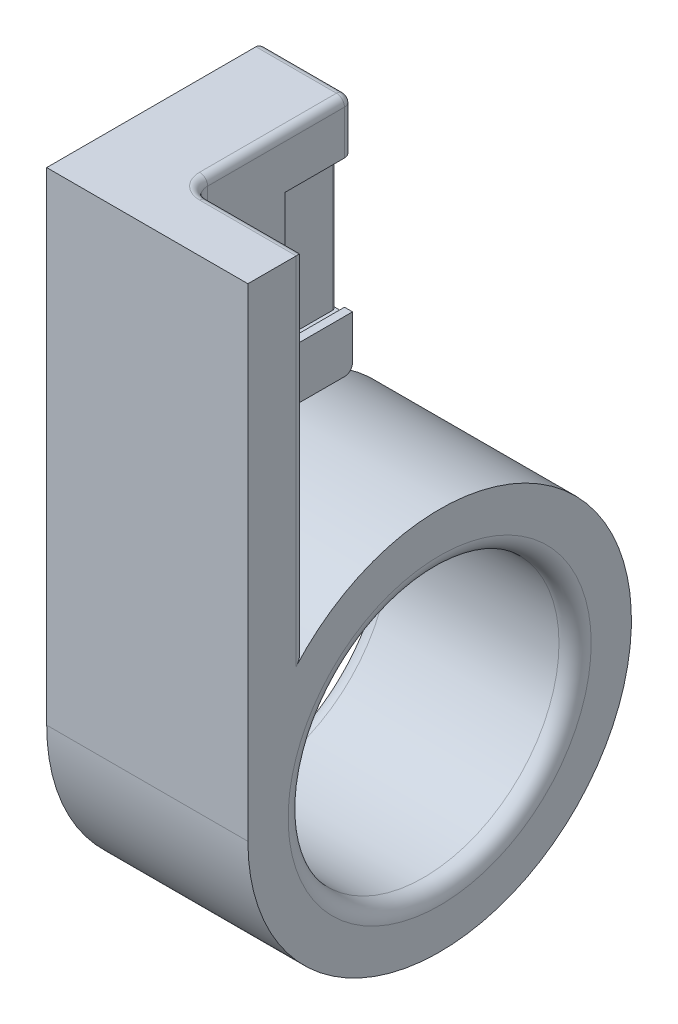
from build123d import *

# Parameters (mm, degrees)
SKETCH1_R           = 23.8275
SKETCH1_R_2         = 16.8275
BOSS_EXTRUDE1_DEPTH = 25
SKETCH2_W           = 25
SKETCH2_H           = 7
BOSS_EXTRUDE2_DEPTH = 60
SKETCH3_W           = 11
SKETCH3_H           = 30
BOSS_EXTRUDE3_DEPTH = 20
SKETCH4_W           = 8.4
SKETCH4_H           = 17.05
CUT_EXTRUDE1_DEPTH  = 1
SKETCH5_W           = 9
SKETCH5_H           = 18.25
CUT_EXTRUDE2_DEPTH  = 1
FILLET1_R           = 0.5
FILLET2_R           = 1
FILLET3_R           = 2
FILLET4_R           = 2
FILLET6_R           = 1


with BuildPart() as part:
    # Sketch1 → Boss-Extrude1 (new body)
    with BuildSketch(Plane(origin=(0, 0, 0), x_dir=(0, 0, -1), z_dir=(1, 0, 0))):
        Circle(SKETCH1_R)
        Circle(SKETCH1_R_2, mode=Mode.SUBTRACT)
    extrude(amount=BOSS_EXTRUDE1_DEPTH)

    # Sketch2 → Boss-Extrude2 (add)
    with BuildSketch(Plane(origin=(0, 0, 0), x_dir=(1, 0, 0), z_dir=(0, 1, 0))):
        with Locations((12.5, -20.3275)):
            Rectangle(SKETCH2_W, SKETCH2_H)
    extrude(amount=BOSS_EXTRUDE2_DEPTH)

    # Sketch3 → Boss-Extrude3 (add)
    with BuildSketch(Plane(origin=(0, 0, 16.8275), x_dir=(-1, 0, 0), z_dir=(0, 0, -1))):
        with Locations((-5.5, 45)):
            Rectangle(SKETCH3_W, SKETCH3_H)
    extrude(amount=BOSS_EXTRUDE3_DEPTH)

    # Sketch4 → Cut-Extrude1 (cut)
    with BuildSketch(Plane(origin=(11, 0, 0), x_dir=(0, 0, -1), z_dir=(1, 0, 0))):
        with Locations((-1.0275, 45)):
            Rectangle(SKETCH4_W, SKETCH4_H)
    extrude(amount=-CUT_EXTRUDE1_DEPTH, mode=Mode.SUBTRACT)

    # Sketch5 → Cut-Extrude2 (cut)
    with BuildSketch(Plane(origin=(10, 0, 0), x_dir=(0, 0, -1), z_dir=(1, 0, 0))):
        with Locations((-1.3275, 45)):
            Rectangle(SKETCH5_W, SKETCH5_H)
    extrude(amount=-CUT_EXTRUDE2_DEPTH, mode=Mode.SUBTRACT)

    # Fillet1
    fillet1_edges = [part.edges().sort_by_distance(p)[0] for p in [
        (9, 45, -3.1725),
    ]]
    fillet(fillet1_edges, radius=FILLET1_R)

    # Fillet2
    fillet2_edges = [part.edges().sort_by_distance(p)[0] for p in [
        (5.5, 30, -3.1725),
        (0, 45, -3.1725),
        (5.5, 60, -3.1725),
    ]]
    fillet(fillet2_edges, radius=FILLET2_R)

    # Fillet3
    fillet3_edges = [part.edges().sort_by_distance(p)[0] for p in [
        (25, 0, 16.8275),
        (0, 0, 16.8275),
    ]]
    fillet(fillet3_edges, radius=FILLET3_R)

    # Fillet4
    fillet4_edges = [part.edges().sort_by_distance(p)[0] for p in [
        (11, 45, 16.8275),
    ]]
    fillet(fillet4_edges, radius=FILLET4_R)

    # Fillet6
    fillet6_edges = [part.edges().sort_by_distance(p)[0] for p in [
        (11, 56.2625, -3.1725),
        (11, 59.707106781, -2.879606781),
        (11, 60, 6.3275),
        (11.585786438, 60, 16.241713562),
        (19, 60, 16.8275),
        (25, 38.43482365, 16.8275),
    ]]
    fillet(fillet6_edges, radius=FILLET6_R)


solid = part.part
